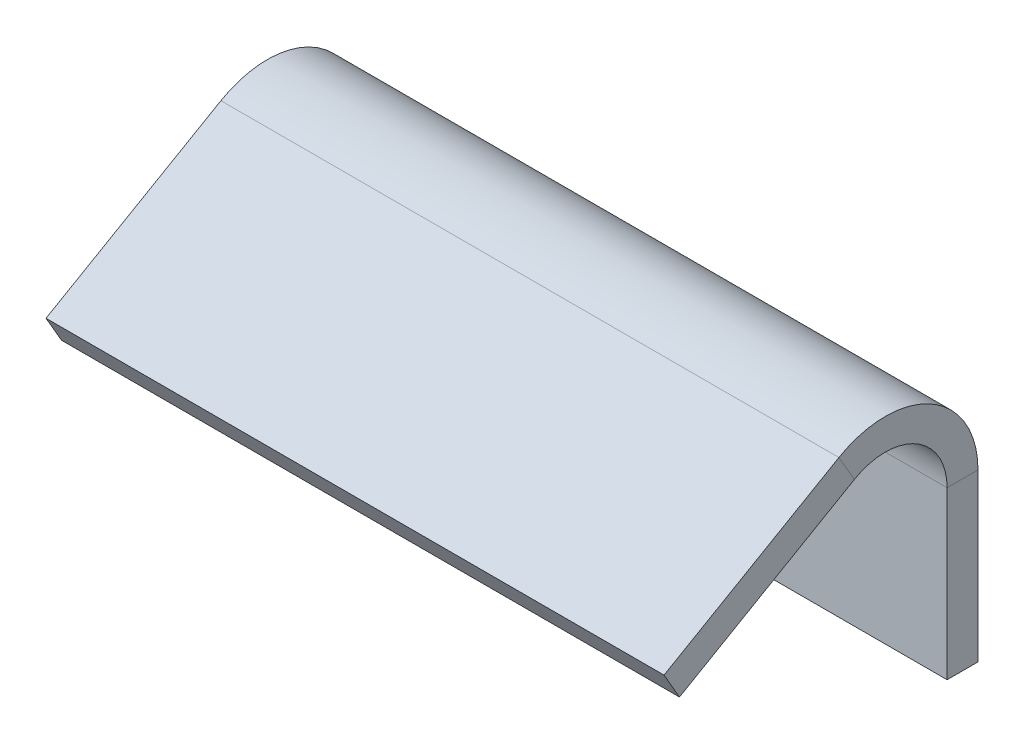
from build123d import *

# Parameters (mm, degrees)
SKETCH_1_W         = 20
SKETCH_1_H         = 10
BASEPLATE_DEPTH    = 1
EDGEFLANGE_DEPTH   = 20
EDGEFLANGE_2_DEPTH = 20


# Read off the part's stored shape, not the designer's step: EdgeFlange
# Sheet-metal steps are written as plain solids
with BuildPart() as part:
    # Sketch 1 → BasePlate (new body)
    with BuildSketch(Plane.XY):
        with Locations((10, 5)):
            Rectangle(SKETCH_1_W, SKETCH_1_H)
    extrude(amount=-BASEPLATE_DEPTH)

    # EdgeFlange outline → EdgeFlange (cut)
    with BuildSketch(Plane.YZ):
        with BuildLine():
            Line((10, 0), (7.617265824, 0))
            ThreePointArc((7.617265824, 0), (6.605942718, -0.738612788), (5.381197846, -1))
            Line((5.381197846, -1), (10, -1))
            Line((10, -1), (10, 0))
        make_face()
    extrude(amount=EDGEFLANGE_DEPTH, mode=Mode.SUBTRACT)

    # EdgeFlange 2 outline → EdgeFlange 2 (add)
    with BuildSketch(Plane.YZ):
        with BuildLine():
            ThreePointArc((7.617265824, 0), (8.365278527, 1.691353778), (7.979274058, 3.5))
            Line((7.979274058, 3.5), (4.711324865, 9.160254038))
            Line((4.711324865, 9.160254038), (3.845299462, 8.660254038))
            Line((3.845299462, 8.660254038), (7.113248654, 3))
            ThreePointArc((7.113248654, 3), (7.113248654, 1), (5.381197846, 0))
            Line((5.381197846, 0), (7.617265824, 0))
        make_face()
    extrude(amount=EDGEFLANGE_2_DEPTH)


solid = part.part
